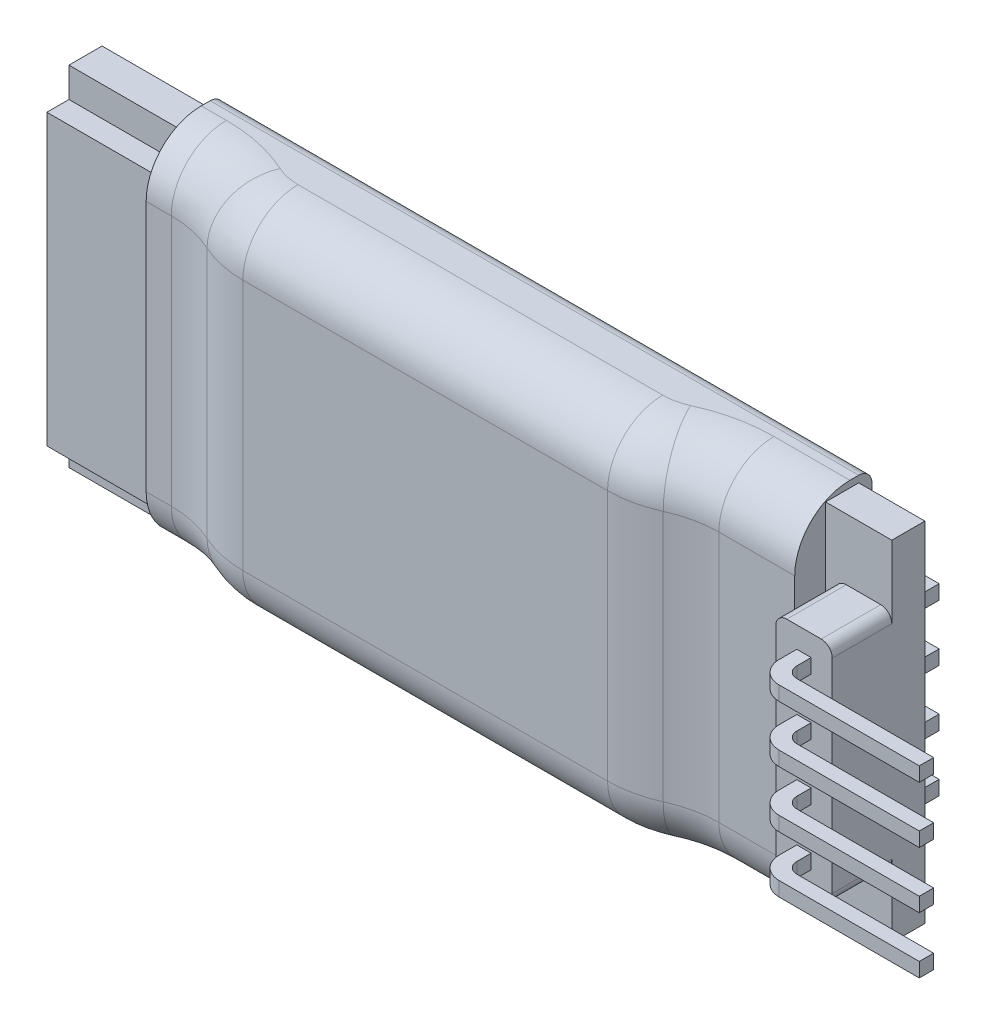
from build123d import *

# Parameters (mm, degrees)
SKICA1_W                     = 37.3
SKICA1_H                     = 15.8
P_IDAT_VYSUNUT_M1_DEPTH      = 1.5
SKICA1_3_W                   = 27.2
SKICA1_3_H                   = 13.1
P_IDAT_VYSUNUT_M2_DEPTH      = 1
SKICA2_W                     = 2.56
SKICA2_H                     = 10.24
P_IDAT_VYSUNUT_M3_DEPTH      = 2.7
P_IDAT_VYSUNUT_M4_DEPTH      = 1.8
P_IDAT_VYSUNUT_M4_DEPTH_BACK = 5.8
SKICA3_W                     = 0.65
SKICA3_H                     = 0.65
SKICA4_W                     = 0.65
SKICA4_H                     = 0.65
P_IDAT_VYSUNUT_M5_DEPTH      = 6.7
ZAOBLIT1_R                   = 1
ZAOBLIT2_R                   = 0.5
P_IDAT_VYSUNUT_M6_DEPTH      = 0.6
P_IDAT_VYSUNUT_M6_DEPTH_BACK = 3.8
SKICA5_W                     = 29.4
SKICA5_H                     = 16.4
SKICA6_W                     = 6.3
SKICA6_H                     = 16.4
ODEBRAT_VYSUNUT_M1_DEPTH     = 0.9
ZAOBLIT3_R                   = 5
ZAOBLIT4_R                   = 5
SKICA7_W                     = 4
SKICA7_H                     = 16.4
ODEBRAT_VYSUNUT_M2_DEPTH     = 0.9
ZAOBLIT7_R                   = 5
ZAOBLIT8_R                   = 5
ZAOBLIT5_R                   = 2.5
ZAOBLIT6_R                   = 0.6
ZAOBLIT9_R                   = 0.5
ZAOBLIT10_R                  = 0.5


with BuildPart() as part:
    # Skica1 → Přidat vysunutím1 (new body)
    with BuildSketch(Plane.XY):
        Rectangle(SKICA1_W, SKICA1_H)
    extrude(amount=-P_IDAT_VYSUNUT_M1_DEPTH)

    # Skica1<3> → Přidat vysunutím2 (add)
    with BuildSketch(Plane.XY):
        with Locations((-5.05, 0)):
            Rectangle(SKICA1_3_W, SKICA1_3_H)
    extrude(amount=P_IDAT_VYSUNUT_M2_DEPTH)

    # Skica2 → Přidat vysunutím3 (add)
    with BuildSketch(Plane.XY):
        with Locations((17.37, 0)):
            Rectangle(SKICA2_W, SKICA2_H)
    extrude(amount=P_IDAT_VYSUNUT_M3_DEPTH)

    # Skica3 → Přidat vysunutím4 (add, two sides: drawn at the far end of the back side and taken through both)
    with BuildSketch(Plane.XY.offset(2.7).offset(-P_IDAT_VYSUNUT_M4_DEPTH_BACK)):
        with Locations((17.37, -3.84)):
            Rectangle(SKICA3_W, SKICA3_H)
        with Locations((17.37, -1.28)):
            Rectangle(SKICA3_W, SKICA3_H)
        with Locations((17.37, 1.28)):
            Rectangle(SKICA3_W, SKICA3_H)
        with Locations((17.37, 3.84)):
            Rectangle(SKICA3_W, SKICA3_H)
    extrude(amount=P_IDAT_VYSUNUT_M4_DEPTH + P_IDAT_VYSUNUT_M4_DEPTH_BACK)

    # Skica4 → Přidat vysunutím5 (add)
    with BuildSketch(Plane(origin=(17.695, 0, 0), x_dir=(0, 0, -1), z_dir=(1, 0, 0))):
        with Locations((-4.175, -3.84)):
            Rectangle(SKICA4_W, SKICA4_H)
        with Locations((-4.175, -1.28)):
            Rectangle(SKICA4_W, SKICA4_H)
        with Locations((-4.175, 1.28)):
            Rectangle(SKICA4_W, SKICA4_H)
        with Locations((-4.175, 3.84)):
            Rectangle(SKICA4_W, SKICA4_H)
    extrude(amount=P_IDAT_VYSUNUT_M5_DEPTH)

    # Zaoblit1
    zaoblit1_edges = [part.edges().sort_by_distance(p)[0] for p in [
        (17.045, 3.84, 4.5),
        (17.045, -3.84, 4.5),
        (17.045, -1.28, 4.5),
        (17.045, 1.28, 4.5),
    ]]
    fillet(zaoblit1_edges, radius=ZAOBLIT1_R)

    # Zaoblit2
    zaoblit2_edges = [part.edges().sort_by_distance(p)[0] for p in [
        (17.695, -3.84, 3.85),
        (17.695, -1.28, 3.85),
        (17.695, 1.28, 3.85),
        (17.695, 3.84, 3.85),
    ]]
    fillet(zaoblit2_edges, radius=ZAOBLIT2_R)

    # Skica5 → Přidat vysunutím6 (add, two sides: drawn at the far end of the back side and taken through both)
    with BuildSketch(Plane(origin=(0, 0, -1.5), x_dir=(-1, 0, 0), z_dir=(0, 0, -1)).offset(-P_IDAT_VYSUNUT_M6_DEPTH_BACK)):
        with Locations((-0.95, 0)):
            Rectangle(SKICA5_W, SKICA5_H)
    extrude(amount=P_IDAT_VYSUNUT_M6_DEPTH + P_IDAT_VYSUNUT_M6_DEPTH_BACK)

    # Skica6 → Odebrat vysunutím1 (cut)
    with BuildSketch(Plane.XY.offset(2.3)):
        with Locations((12.5, 0)):
            Rectangle(SKICA6_W, SKICA6_H)
    extrude(amount=-ODEBRAT_VYSUNUT_M1_DEPTH, mode=Mode.SUBTRACT)

    # Zaoblit3
    # the kernel refuses this fillet: 5 mm, written as the material it adds along each edge
    with BuildSketch(Plane(origin=(9.35, -8.2, 1.4), x_dir=(1, 0, 0), z_dir=(0, 1, 0))) as zaoblit3_piece_1:
        with BuildLine():
            CenterArc((2.861817604, -5), ZAOBLIT3_R, 90, 34.915206247)
            Line((0, -0.9), (-0.057236352, -0.818))
            ThreePointArc((-0.057236352, -0.818), (-0.1, -0.45), (-0.1, 0))
            Line((-0.1, 0), (0, 0.1))
            Line((0, 0.1), (2.861817604, 0.1))
            Line((2.861817604, 0.1), (2.861817604, 0))
        make_face()
    extrude(amount=16.4)

    # Zaoblit4
    zaoblit4_edges = [part.edges().sort_by_distance(p)[0] for p in [
        (9.35, 0, 2.3),
    ]]
    fillet(zaoblit4_edges, radius=ZAOBLIT4_R)

    # Skica7 → Odebrat vysunutím2 (cut)
    with BuildSketch(Plane.XY.offset(2.3)):
        with Locations((-11.75, 0)):
            Rectangle(SKICA7_W, SKICA7_H)
    extrude(amount=-ODEBRAT_VYSUNUT_M2_DEPTH, mode=Mode.SUBTRACT)

    # Zaoblit7
    # the kernel refuses this fillet: 5 mm, written as the material it adds along each edge
    with BuildSketch(Plane(origin=(-9.75, 8.2, 1.4), x_dir=(-1, 0, 0), z_dir=(0, -1, 0))) as zaoblit7_piece_1:
        with BuildLine():
            CenterArc((2.861817604, -5), ZAOBLIT7_R, 90, 34.915206247)
            Line((0, -0.9), (0, 0))
            Line((0, 0), (2.861817604, 0))
        make_face()
    extrude(amount=16.4)

    # Zaoblit8
    zaoblit8_edges = [part.edges().sort_by_distance(p)[0] for p in [
        (-9.75, 0, 2.3),
    ]]
    fillet(zaoblit8_edges, radius=ZAOBLIT8_R)

    # Zaoblit5
    zaoblit5_edges = [part.edges().sort_by_distance(p)[0] for p in [
        (13.930908802, 8.2, 1.4),
        (13.930908802, -8.2, 1.4),
        (11.151157432, -8.2, 1.513794929),
        (11.151157432, 8.2, 1.513794929),
        (-0.2, -8.2, 2.3),
        (9.126395288, -8.2, 2.186205071),
        (9.126395288, 8.2, 2.186205071),
        (-13.180908802, -8.2, 1.4),
        (-13.180908802, 8.2, 1.4),
        (-11.551157432, 8.2, 1.513794929),
        (-11.551157432, -8.2, 1.513794929),
        (-0.2, 8.2, 2.3),
        (-9.526395288, 8.2, 2.186205071),
        (-9.526395288, -8.2, 2.186205071),
    ]]
    fillet(zaoblit5_edges, radius=ZAOBLIT5_R)

    # Zaoblit6
    zaoblit6_edges = [part.edges().sort_by_distance(p)[0] for p in [
        (0.95, 8.2, -2.1),
        (0.95, -8.2, -2.1),
    ]]
    fillet(zaoblit6_edges, radius=ZAOBLIT6_R)

    # Zaoblit9
    zaoblit9_edges = [part.edges().sort_by_distance(p)[0] for p in [
        (18.65, -5.12, 1.35),
        (18.65, 5.12, 1.35),
        (16.09, 5.12, 1.35),
        (16.09, -5.12, 1.35),
    ]]
    fillet(zaoblit9_edges, radius=ZAOBLIT9_R)

    # Zaoblit10
    zaoblit10_edges = [part.edges().sort_by_distance(p)[0] for p in [
        (17.695, 3.84, -1.5),
        (17.37, 3.515, -1.5),
        (17.045, 3.84, -1.5),
        (17.37, 4.165, -1.5),
        (17.045, -3.84, -1.5),
        (17.37, -3.515, -1.5),
        (17.695, -3.84, -1.5),
        (17.37, -4.165, -1.5),
        (17.045, -1.28, -1.5),
        (17.37, -0.955, -1.5),
        (17.695, -1.28, -1.5),
        (17.37, -1.605, -1.5),
        (17.695, 1.28, -1.5),
        (17.37, 0.955, -1.5),
        (17.045, 1.28, -1.5),
        (17.37, 1.605, -1.5),
    ]]
    fillet(zaoblit10_edges, radius=ZAOBLIT10_R)


solid = part.part
